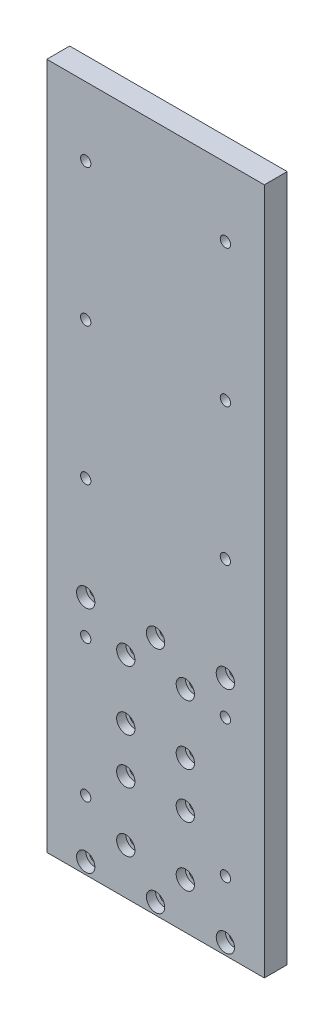
from build123d import *

# Parameters (mm, degrees)
SCHIZZO1_W                   = 95
SCHIZZO1_H                   = 300
ESTRUSIONE_ESTRUSIONE1_DEPTH = 10
SCHIZZO2_R                   = 2.25
TAGLIO_ESTRUSIONE1_DEPTH     = 315.841229829
SCHIZZO4_R                   = 4
TAGLIO_ESTRUSIONE2_DEPTH     = 4
SCHIZZO5_R                   = 2
TAGLIO_ESTRUSIONE3_DEPTH     = 315.841229829
FORO_PER_VITE_M4_1_D         = 4.5
FORO_PER_VITE_M4_1_DEPTH     = 10
FORO_PER_VITE_M4_1_TIP       = 1.351936393


with BuildPart() as part:
    # Schizzo1 → Estrusione-Estrusione1 (new body)
    with BuildSketch(Plane.XY):
        with Locations((47.5, 150)):
            Rectangle(SCHIZZO1_W, SCHIZZO1_H)
    extrude(amount=-ESTRUSIONE_ESTRUSIONE1_DEPTH)

    # Schizzo2 → Taglio-Estrusione1 (cut, through all)
    with BuildSketch(Plane.XY):
        with Locations((17, 105)):
            Circle(SCHIZZO2_R)
        with Locations((17, 5)):
            Circle(SCHIZZO2_R)
        with Locations((34.5, 20)):
            Circle(SCHIZZO2_R)
        with Locations((34.5, 46)):
            Circle(SCHIZZO2_R)
        with Locations((34.5, 66)):
            Circle(SCHIZZO2_R)
        with Locations((34.5, 92)):
            Circle(SCHIZZO2_R)
        with Locations((47.5, 105)):
            Circle(SCHIZZO2_R)
        with Locations((47.5, 5)):
            Circle(SCHIZZO2_R)
        with Locations((60.5, 92)):
            Circle(SCHIZZO2_R)
        with Locations((60.5, 66)):
            Circle(SCHIZZO2_R)
        with Locations((60.5, 46)):
            Circle(SCHIZZO2_R)
        with Locations((60.5, 20)):
            Circle(SCHIZZO2_R)
        with Locations((78, 5)):
            Circle(SCHIZZO2_R)
        with Locations((78, 105)):
            Circle(SCHIZZO2_R)
    extrude(amount=-TAGLIO_ESTRUSIONE1_DEPTH, mode=Mode.SUBTRACT)

    # Schizzo4 → Taglio-Estrusione2 (cut)
    with BuildSketch(Plane.XY):
        with Locations((17, 105)):
            Circle(SCHIZZO4_R)
        with Locations((47.5, 105)):
            Circle(SCHIZZO4_R)
        with Locations((78, 105)):
            Circle(SCHIZZO4_R)
        with Locations((34.5, 92)):
            Circle(SCHIZZO4_R)
        with Locations((60.5, 92)):
            Circle(SCHIZZO4_R)
        with Locations((34.5, 66)):
            Circle(SCHIZZO4_R)
        with Locations((60.5, 66)):
            Circle(SCHIZZO4_R)
        with Locations((34.5, 46)):
            Circle(SCHIZZO4_R)
        with Locations((60.5, 46)):
            Circle(SCHIZZO4_R)
        with Locations((17, 5)):
            Circle(SCHIZZO4_R)
        with Locations((34.5, 20)):
            Circle(SCHIZZO4_R)
        with Locations((60.5, 20)):
            Circle(SCHIZZO4_R)
        with Locations((47.5, 5)):
            Circle(SCHIZZO4_R)
        with Locations((78, 5)):
            Circle(SCHIZZO4_R)
    extrude(amount=-TAGLIO_ESTRUSIONE2_DEPTH, mode=Mode.SUBTRACT)

    # Schizzo5 → Taglio-Estrusione3 (cut, through all)
    with BuildSketch(Plane.XY):
        with Locations((78, 150)):
            Circle(SCHIZZO5_R)
        with Locations((78, 210)):
            Circle(SCHIZZO5_R)
        with Locations((78, 270)):
            Circle(SCHIZZO5_R)
        with Locations((78, 30)):
            Circle(SCHIZZO5_R)
        with Locations((78, 90)):
            Circle(SCHIZZO5_R)
        with Locations((17, 90)):
            Circle(SCHIZZO5_R)
        with Locations((17, 30)):
            Circle(SCHIZZO5_R)
        with Locations((17, 270)):
            Circle(SCHIZZO5_R)
        with Locations((17, 210)):
            Circle(SCHIZZO5_R)
        with Locations((17, 150)):
            Circle(SCHIZZO5_R)
    extrude(amount=-TAGLIO_ESTRUSIONE3_DEPTH, mode=Mode.SUBTRACT)

    # Foro per Vite M4-1
    with Locations(Plane(origin=(17, 270, 0), x_dir=(1, 0, 0), z_dir=(0, 0, 1))):
        with Locations((0, 0), (61, 0), (0, -60), (61, -60), (0, -120), (61, -120), (0, -180), (61, -180), (0, -240), (61, -240)):
            Hole(FORO_PER_VITE_M4_1_D / 2, depth=FORO_PER_VITE_M4_1_DEPTH)
            with Locations((0, 0, -(FORO_PER_VITE_M4_1_DEPTH + FORO_PER_VITE_M4_1_TIP / 2))):  # 118° drill point
                Cone(0, FORO_PER_VITE_M4_1_D / 2, FORO_PER_VITE_M4_1_TIP, mode=Mode.SUBTRACT)


solid = part.part
